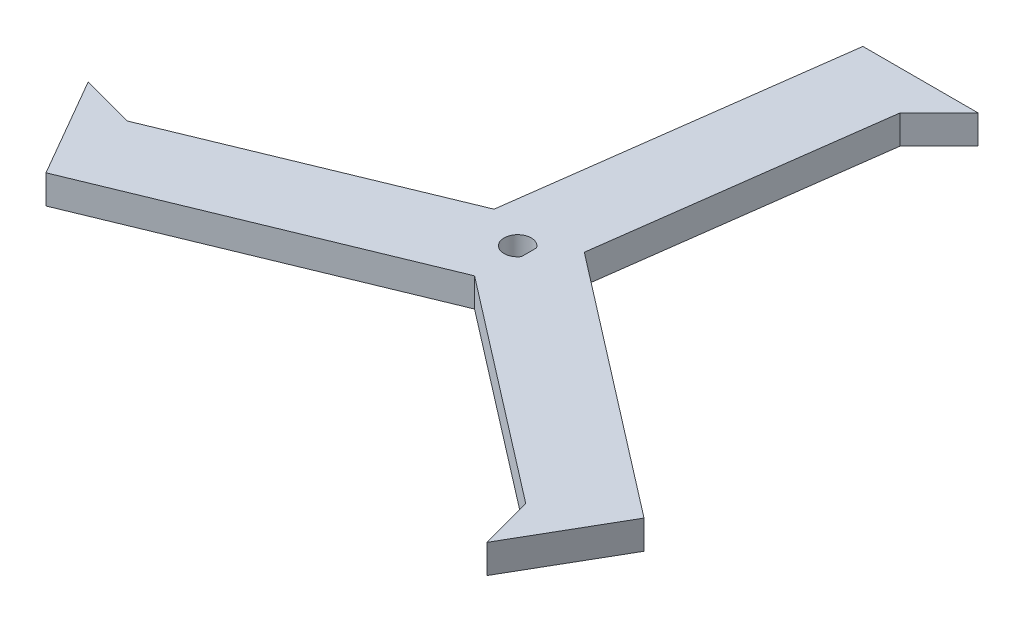
from build123d import *

# Parameters (mm, degrees)
BOSS_EXTRUDE1_DEPTH = 6.35


with BuildPart() as part:
    # Sketch2 → Boss-Extrude1 (new body)
    with BuildSketch(Plane(origin=(0, 0, 0), x_dir=(1, 0, 0), z_dir=(0, 1, 0))):
        Polygon((25.4, 76.2), (0, 76.2), (-9.593700898, 4.38844936), (-66.961592105, -19.245876496), (-78.691135768, -16.102954744), (-65.991135768, -38.1), (0.99634182, -10.502613374), (50.148214016, -48.367501593), (53.291135768, -60.097045256), (65.991135768, -38.1), (8.597359078, 6.114164014), (16.813378089, 67.613378089), align=None)
        with BuildLine():
            ThreePointArc((2.499994, -1.658310586), (-2.999994, 0), (2.499994, 1.658310586))
            Line((2.499994, 1.658310586), (2.499994, -1.658310586))
        make_face(mode=Mode.SUBTRACT)
    extrude(amount=BOSS_EXTRUDE1_DEPTH)


solid = part.part
